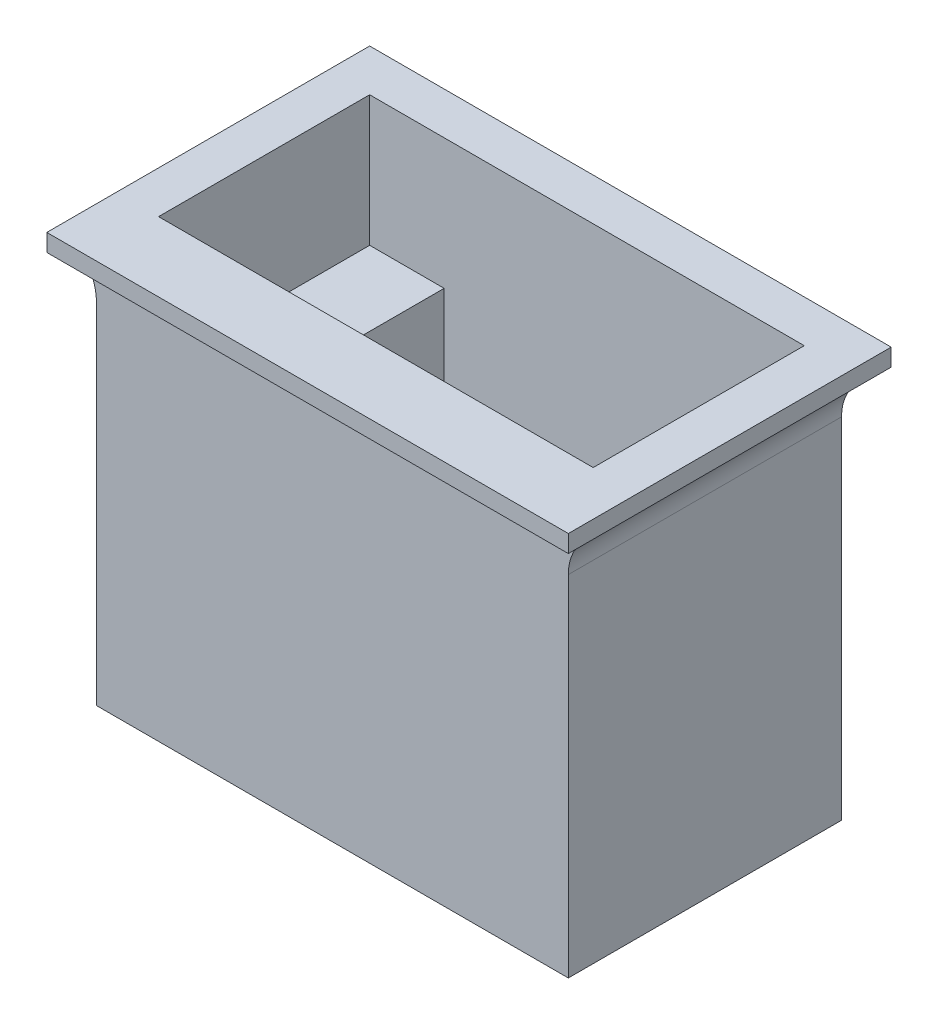
from build123d import *

# Parameters (mm, degrees)
SKETCH1_W           = 38
SKETCH1_H           = 22
BOSS_EXTRUDE1_DEPTH = 33
SKETCH2_W           = 35
SKETCH2_H           = 17
CUT_EXTRUDE1_DEPTH  = 28
SKETCH3_W           = 6
SKETCH3_H           = 17
BOSS_EXTRUDE2_DEPTH = 17.5
SKETCH4_W           = 42
SKETCH4_H           = 26
SKETCH4_W_2         = 38
SKETCH4_H_2         = 22
EXTRUDE_THIN2_DEPTH = 1.4
SKETCH5_R           = 1
CUT_EXTRUDE2_DEPTH  = 3
SKETCH6_R           = 1
CUT_EXTRUDE3_DEPTH  = 3
SKETCH7_W           = 9.4
SKETCH7_H           = 4.5
CUT_EXTRUDE4_DEPTH  = 10
SKETCH8_W           = 20
SKETCH8_H           = 10
CUT_EXTRUDE5_DEPTH  = 3.5
SKETCH9_R           = 3.7
SKETCH9_R_2         = 1
CUT_EXTRUDE6_DEPTH  = 47.845174865
FILLET1_R           = 4
FILLET2_R           = 3
FILLET3_R           = 4


with BuildPart() as part:
    # Sketch1 → Boss-Extrude1 (new body)
    with BuildSketch(Plane(origin=(0, 0, 0), x_dir=(1, 0, 0), z_dir=(0, 1, 0))):
        with Locations((8.6, -5.057142857)):
            Rectangle(SKETCH1_W, SKETCH1_H)
    extrude(amount=BOSS_EXTRUDE1_DEPTH)

    # Sketch2 → Cut-Extrude1 (cut)
    with BuildSketch(Plane(origin=(0, 33, 0), x_dir=(1, 0, 0), z_dir=(0, 1, 0))):
        with Locations((8.5, -3.957142857)):
            Rectangle(SKETCH2_W, SKETCH2_H)
    extrude(amount=-CUT_EXTRUDE1_DEPTH, mode=Mode.SUBTRACT)

    # Sketch3 → Boss-Extrude2 (add)
    with BuildSketch(Plane(origin=(0, 5, 0), x_dir=(1, 0, 0), z_dir=(0, 1, 0))):
        with Locations((-6, -3.957142857)):
            Rectangle(SKETCH3_W, SKETCH3_H)
        with Locations((23, -3.957142857)):
            Rectangle(SKETCH3_W, SKETCH3_H)
    extrude(amount=BOSS_EXTRUDE2_DEPTH)

    # Sketch4 → Extrude-Thin2 (add)
    with BuildSketch(Plane(origin=(0, 33, 0), x_dir=(1, 0, 0), z_dir=(0, 1, 0))):
        with Locations((8.6, -5.057142857)):
            Rectangle(SKETCH4_W, SKETCH4_H)
        with Locations((8.6, -5.057142857)):
            Rectangle(SKETCH4_W_2, SKETCH4_H_2, mode=Mode.SUBTRACT)
    extrude(amount=-EXTRUDE_THIN2_DEPTH)

    # Sketch5 → Cut-Extrude2 (cut)
    with BuildSketch(Plane(origin=(0, 22.5, 0), x_dir=(1, 0, 0), z_dir=(0, 1, 0))):
        with Locations(Location((-5.5, -3.892148731, 0), (0, 0, 270))):
            Circle(SKETCH5_R)
    extrude(amount=-CUT_EXTRUDE2_DEPTH, mode=Mode.SUBTRACT)

    # Sketch6 → Cut-Extrude3 (cut)
    with BuildSketch(Plane(origin=(0, 22.5, 0), x_dir=(1, 0, 0), z_dir=(0, 1, 0))):
        with Locations(Location((22.953148274, -4.115727136, 0), (0, 0, 270))):
            Circle(SKETCH6_R)
    extrude(amount=-CUT_EXTRUDE3_DEPTH, mode=Mode.SUBTRACT)

    # Sketch7 → Cut-Extrude4 (cut)
    with BuildSketch(Plane(origin=(-3, 0, 0), x_dir=(0, 0, -1), z_dir=(1, 0, 0))):
        with Locations((-3.757142857, 6.291369126)):
            Rectangle(SKETCH7_W, SKETCH7_H)
    extrude(amount=-CUT_EXTRUDE4_DEPTH, mode=Mode.SUBTRACT)

    # Sketch8 → Cut-Extrude5 (cut)
    with BuildSketch(Plane(origin=(0, 5, 0), x_dir=(1, 0, 0), z_dir=(0, 1, 0))):
        with Locations((8.592117784, -3.72787339)):
            Rectangle(SKETCH8_W, SKETCH8_H)
    extrude(amount=-CUT_EXTRUDE5_DEPTH, mode=Mode.SUBTRACT)

    # Sketch9 → Cut-Extrude6 (cut, through all)
    with BuildSketch(Plane(origin=(0, 1.5, 0), x_dir=(1, 0, 0), z_dir=(0, 1, 0))):
        with Locations(Location((8.808284604, -3.634888569, 0), (0, 0, 270))):
            Circle(SKETCH9_R)
        with Locations(Location((1.608284604, -3.634888569, 0), (0, 0, 270))):
            Circle(SKETCH9_R_2)
        with Locations(Location((16.008284604, -3.634888569, 0), (0, 0, 270))):
            Circle(SKETCH9_R_2)
    extrude(amount=-CUT_EXTRUDE6_DEPTH, mode=Mode.SUBTRACT)

    # Fillet1
    fillet1_edges = [part.edges().sort_by_distance(p)[0] for p in [
        (-1.407882216, 3.25, 8.72787339),
        (-1.407882216, 3.25, -1.27212661),
        (18.592117784, 3.25, -1.27212661),
        (18.592117784, 3.25, 8.72787339),
    ]]
    fillet(fillet1_edges, radius=FILLET1_R)

    # Fillet2
    fillet2_edges = [part.edges().sort_by_distance(p)[0] for p in [
        (-3, 8.541369126, 3.757142857),
    ]]
    fillet(fillet2_edges, radius=FILLET2_R)

    # Fillet3
    # the kernel refuses this fillet: 4 mm, written as the material it adds along each edge
    with BuildSketch(Plane(origin=(-10.4, 31.6, 16.057142857), x_dir=(-1, 0, 0), z_dir=(0, 0, -1)), Plane(origin=(27.6, 31.6, -5.942857143), x_dir=(1, 0, 0), z_dir=(0, 0, 1))) as fillet3_piece_1:
        with BuildLine():
            CenterArc((4, -3.464101615), FILLET3_R, 120, 60)
            Line((0, -3.464101615), (-0.08, -3.464101615))
            Line((-0.08, -3.464101615), (-0.08, 0))
            Line((-0.08, 0), (0, 0.08))
            ThreePointArc((0, 0.08), (1, 0.08), (1.96, 0.069282032))
            Line((1.96, 0.069282032), (2, 0))
        make_face()
    extrude(amount=22)


solid = part.part
